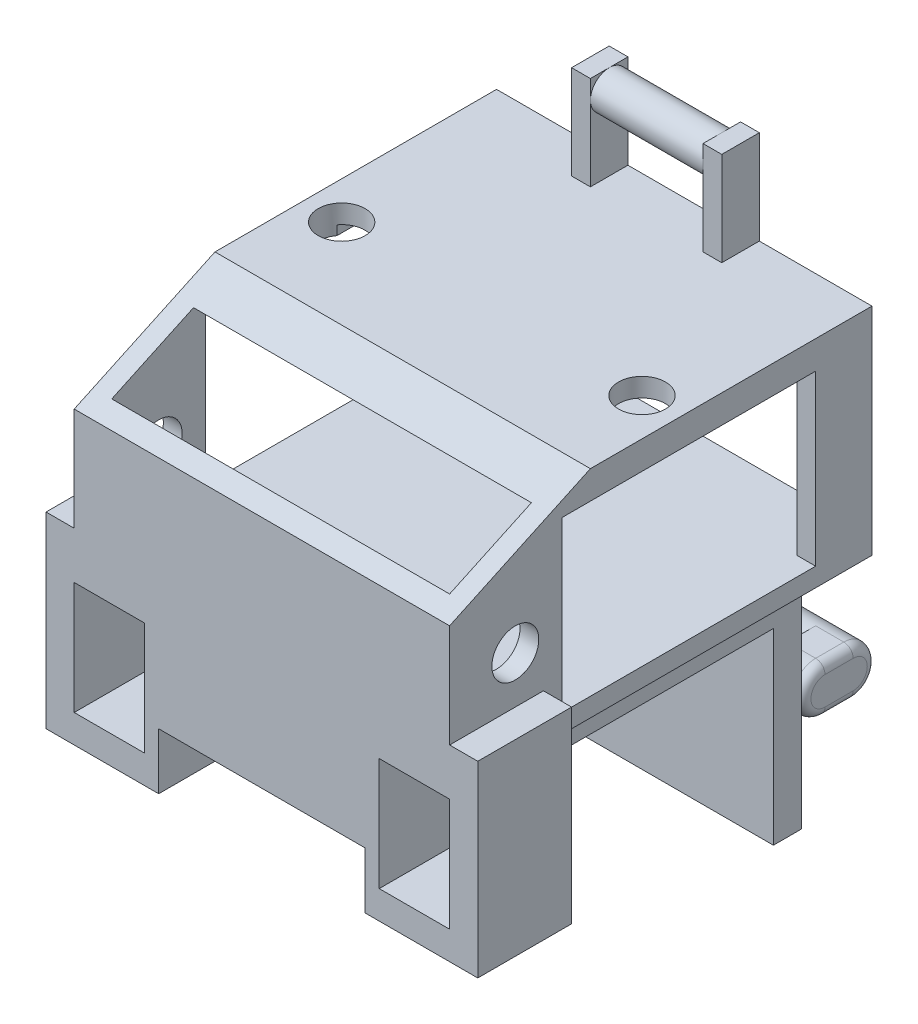
from build123d import *
from build123d.topology import SkipClean

# Parameters (mm, degrees)
SKETCH_1_W               = 25
SKETCH_1_H               = 42
EXTRUDE_1_DEPTH          = 9
SKETCH_2_W               = 25
SKETCH_2_H               = 29
EXTRUDE_2_DEPTH          = 3
SKETCH_3_W               = 40
SKETCH_3_H               = 45
EXTRUDE_3_DEPTH          = 23
SKETCH_4_W               = 36
SKETCH_4_H               = 19
CUT_EXTRUDE_1_DEPTH      = 43
SKETCH_6_W               = 10
SKETCH_6_H               = 20
EXTRUDE_4_DEPTH          = 3
SKETCH_7_W               = 9
SKETCH_7_H               = 10
EXTRUDE_5_DEPTH          = 3
SKETCH_8_W               = 2
SKETCH_8_H               = 4
EXTRUDE_6_DEPTH          = 10
EXTRUDE_7_REACH          = 70.044
SKETCH_9_R               = 2
SKETCH_10_R              = 2.5
CUT_EXTRUDE_2_DEPTH      = 76.08661665
SKETCH_11_R              = 2.5
EXTRUDE_8_DEPTH          = 9
SKETCH_12_R              = 2.5
EXTRUDE_9_DEPTH          = 7
EXTRUDE_10_DEPTH         = 4
FILLET_1_R               = 1
FILLET_1_OF_MIRROR_2_R   = 1
CUT_EXTRUDE_3_DEPTH      = 82.1372295
CUT_EXTRUDE_5_DEPTH      = 81.095255858
CUT_EXTRUDE_5_DEPTH_BACK = 81.095255858
SKETCH_19_W              = 27
SKETCH_19_H              = 18
CUT_EXTRUDE_6_DEPTH      = 84.273645356
CUT_EXTRUDE_6_DEPTH_BACK = 10
SKETCH_20_R              = 2.5
SKETCH_23_W              = 10
SKETCH_23_H              = 3
EXTRUDE_13_DEPTH         = 1.5


with BuildPart() as part:
    # ｽｹｯﾁ1 → ﾎﾞｽ - 押し出し1 (new body)
    with BuildSketch(Plane(origin=(0, 0, 0), x_dir=(1, 0, 0), z_dir=(0, 1, 0))):
        with Locations((12.5, 21)):
            Rectangle(SKETCH_1_W, SKETCH_1_H)
    extrude(amount=EXTRUDE_1_DEPTH)

    # ｽｹｯﾁ2 → ﾎﾞｽ - 押し出し2 (add)
    with BuildSketch(Plane(origin=(0, 0, -42), x_dir=(-1, 0, 0), z_dir=(0, 0, -1))):
        with Locations((-12.5, -5.5)):
            Rectangle(SKETCH_2_W, SKETCH_2_H)
    extrude(amount=EXTRUDE_2_DEPTH)

    # ｽｹｯﾁ3 → ﾎﾞｽ - 押し出し3 (add)
    with BuildSketch(Plane(origin=(0, 9, 0), x_dir=(1, 0, 0), z_dir=(0, 1, 0))):
        with Locations((12.5, 22.5)):
            Rectangle(SKETCH_3_W, SKETCH_3_H)
    extrude(amount=EXTRUDE_3_DEPTH)

    # ｽｹｯﾁ4 → ｶｯﾄ - 押し出し1 (cut)
    with BuildSketch(Plane(origin=(0, 0, -45), x_dir=(-1, 0, 0), z_dir=(0, 0, -1))):
        with Locations((-12.5, 20.5)):
            Rectangle(SKETCH_4_W, SKETCH_4_H)
    extrude(amount=-CUT_EXTRUDE_1_DEPTH, mode=Mode.SUBTRACT)

    # ｽｹｯﾁ6 → ﾎﾞｽ - 押し出し4 (add)
    with BuildSketch(Plane(origin=(32.5, 0, 0), x_dir=(0, 0, -1), z_dir=(1, 0, 0))):
        with Locations((5, 4)):
            Rectangle(SKETCH_6_W, SKETCH_6_H)
    extrude_4 = extrude(amount=EXTRUDE_4_DEPTH)

    # ｽｹｯﾁ7 → ﾎﾞｽ - 押し出し5 (add)
    with BuildSketch(Plane.XZ.offset(6)):
        with Locations((28, -5)):
            Rectangle(SKETCH_7_W, SKETCH_7_H)
    extrude_5 = extrude(amount=-EXTRUDE_5_DEPTH)

    # ﾐﾗｰ1: ﾎﾞｽ - 押し出し4, ﾎﾞｽ - 押し出し5 across plane
    add(extrude_4.mirror(Plane(origin=(12.5, 0, 0), x_dir=(0, 0, 1), z_dir=(1, 0, 0))))
    add(extrude_5.mirror(Plane(origin=(12.5, 0, 0), x_dir=(0, 0, 1), z_dir=(1, 0, 0))))

    # ｽｹｯﾁ8 → ﾎﾞｽ - 押し出し6 (add)
    with BuildSketch(Plane(origin=(0, 32, 0), x_dir=(1, 0, 0), z_dir=(0, 1, 0))):
        with Locations((5.5, 43)):
            Rectangle(SKETCH_8_W, SKETCH_8_H)
        with Locations((19.5, 43)):
            Rectangle(SKETCH_8_W, SKETCH_8_H)
    extrude(amount=EXTRUDE_6_DEPTH)

    # ｽｹｯﾁ9 → ﾎﾞｽ - 押し出し7 (add, up to next)
    with BuildSketch(Plane(origin=(6.5, 0, 0), x_dir=(0, 0, -1), z_dir=(1, 0, 0)), mode=Mode.PRIVATE) as extrude_7_sk1:
        with Locations((43, 40)):
            Circle(SKETCH_9_R)
    extrude_7_tool1 = extrude(extrude_7_sk1.sketch, amount=EXTRUDE_7_REACH, mode=Mode.PRIVATE) - part.part
    add(extrude_7_tool1.solids().sort_by_distance((6.5, 40, -43))[0])

    # ｽｹｯﾁ10 → ｶｯﾄ - 押し出し2 (cut, through all)
    with BuildSketch(Plane.ZY.offset(7.5)):
        with Locations((-7, 19)):
            Circle(SKETCH_10_R)
    extrude(amount=-CUT_EXTRUDE_2_DEPTH, mode=Mode.SUBTRACT)

    # ｽｹｯﾁ11 → ﾎﾞｽ - 押し出し8 (add)
    with BuildSketch(Plane(origin=(0, 0, -45), x_dir=(-1, 0, 0), z_dir=(0, 0, -1))):
        with Locations((-12.5, -10)):
            Circle(SKETCH_11_R)
    extrude(amount=EXTRUDE_8_DEPTH)

    # ｽｹｯﾁ12 → ﾎﾞｽ - 押し出し9 (add)
    with BuildSketch(Plane(origin=(12.5, 0, 0), x_dir=(0, 0, -1), z_dir=(1, 0, 0))):
        with Locations((52, -10)):
            Circle(SKETCH_12_R)
    extrude_9 = extrude(amount=EXTRUDE_9_DEPTH)

    # ｽｹｯﾁ13 → ﾎﾞｽ - 押し出し10 (add)
    with SkipClean():  # the faces are left unmerged after this step: merging them gives an invalid solid
        with BuildSketch(Plane(origin=(19.5, 0, 0), x_dir=(0, 0, -1), z_dir=(1, 0, 0))):
            with BuildLine():
                Line((52, -12.5), (49, -12.5))
                ThreePointArc((49, -12.5), (46.5, -10), (49, -7.5))
                Line((49, -7.5), (52, -7.5))
                ThreePointArc((52, -7.5), (54.5, -10), (52, -12.5))
            make_face()
        extrude_10 = extrude(amount=EXTRUDE_10_DEPTH)
    add(part.part.scale(1), mode=Mode.REPLACE)  # the faces are merged on a copy

    # ﾌｨﾚｯﾄ1
    fillet_1_edges = [part.edges().sort_by_distance(p)[0] for p in [
        (23.5, -12.5, -50.5),
        (23.5, -10, -46.5),
        (23.5, -7.5, -50.5),
        (23.5, -10, -54.5),
    ]]
    fillet(fillet_1_edges, radius=FILLET_1_R)

    # ﾐﾗｰ2: ﾎﾞｽ - 押し出し9, ﾎﾞｽ - 押し出し10 across plane
    add(extrude_9.mirror(Plane(origin=(12.5, 0, 0), x_dir=(0, 0, 1), z_dir=(1, 0, 0))))
    add(extrude_10.mirror(Plane(origin=(12.5, 0, 0), x_dir=(0, 0, 1), z_dir=(1, 0, 0))))

    # ﾌｨﾚｯﾄ1 of ﾐﾗｰ2
    fillet_1_of_mirror_2_edges = [part.edges().sort_by_distance(p)[0] for p in [
        (1.5, -12.5, -50.5),
        (1.5, -10, -46.5),
        (1.5, -7.5, -50.5),
        (1.5, -10, -54.5),
    ]]
    fillet(fillet_1_of_mirror_2_edges, radius=FILLET_1_OF_MIRROR_2_R)

    # ｽｹｯﾁ14 → ｶｯﾄ - 押し出し3 (cut, through all)
    with BuildSketch(Plane.ZY.offset(7.5)):
        Polygon((-15, 32), (0, 25), (0, 32), align=None)
    extrude(amount=-CUT_EXTRUDE_3_DEPTH, mode=Mode.SUBTRACT)

    # ｽｹｯﾁ19 → ｶｯﾄ - 押し出し5 (cut, two sides: drawn at the far end of the back side and taken through both)
    with BuildSketch(Plane.ZY.offset(-30.5).offset(-CUT_EXTRUDE_5_DEPTH_BACK)):
        with Locations((-25.5, 20)):
            Rectangle(SKETCH_19_W, SKETCH_19_H)
    extrude(amount=CUT_EXTRUDE_5_DEPTH + CUT_EXTRUDE_5_DEPTH_BACK, mode=Mode.SUBTRACT)

    # ｽｹｯﾁ20 → ｶｯﾄ - 押し出し6 (cut, two sides: drawn at the far end of the back side and taken through both)
    with BuildSketch(Plane(origin=(0, 32, 0), x_dir=(1, 0, 0), z_dir=(0, 1, 0)).offset(-CUT_EXTRUDE_6_DEPTH_BACK)):
        with Locations((-3.5, 24.5)):
            Circle(SKETCH_20_R)
        with Locations((28.5, 24.5)):
            Circle(SKETCH_20_R)
    extrude(amount=CUT_EXTRUDE_6_DEPTH + CUT_EXTRUDE_6_DEPTH_BACK, mode=Mode.SUBTRACT)

    # ｽｹｯﾁ23 → ﾎﾞｽ - 押し出し13 (add)
    with BuildSketch(Plane.ZY.offset(-23.5)):
        with Locations((-5, -1.5)):
            Rectangle(SKETCH_23_W, SKETCH_23_H)
    extrude_13 = extrude(amount=-EXTRUDE_13_DEPTH)

    # ﾐﾗｰ3: ﾎﾞｽ - 押し出し13 across plane
    add(extrude_13.mirror(Plane(origin=(12.5, 0, 0), x_dir=(0, 0, 1), z_dir=(1, 0, 0))))


solid = part.part
